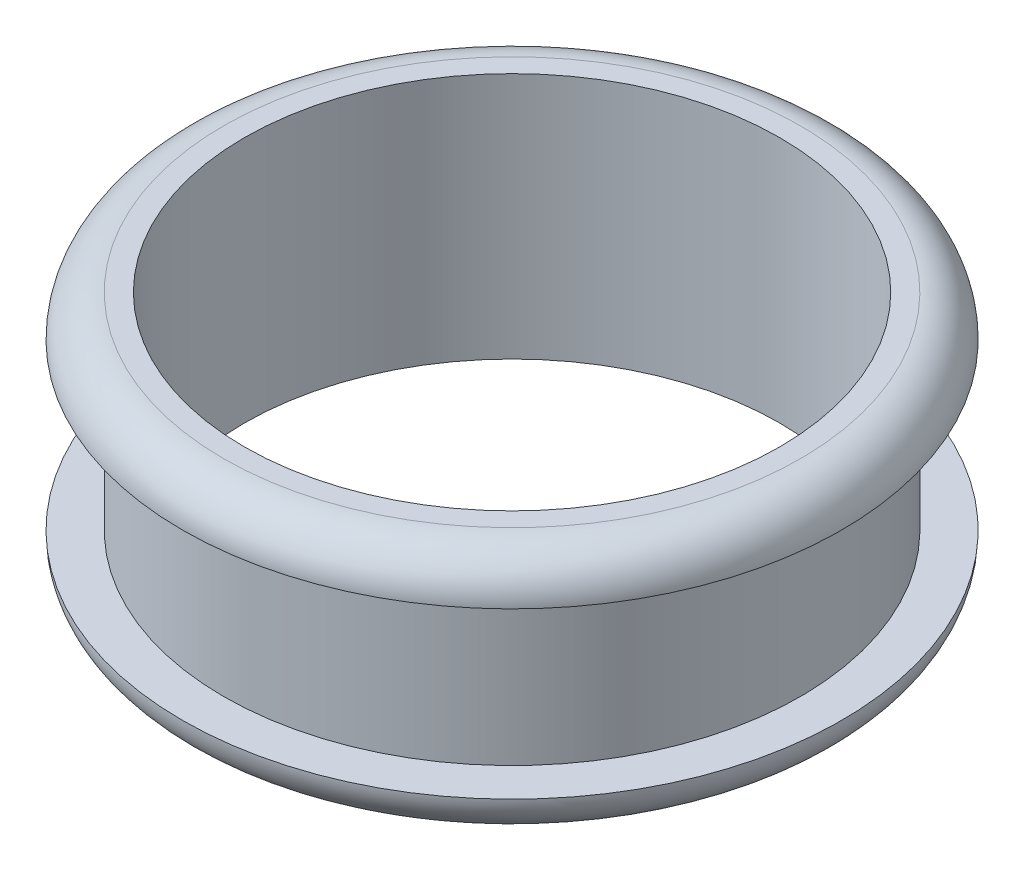
from build123d import *

# Parameters (mm, degrees)
SKETCH1_R               = 4
BOSS_EXTRUDE1_DEPTH     = 1.5
CUT_EXTRUDE1_DEPTH      = 6.852349955
CUT_EXTRUDE1_DEPTH_BACK = 6.852349955
SKETCH2_R               = 3.25
SKETCH4_W               = 0.5
SKETCH4_H               = 2
FILLET1_R               = 0.5


with BuildPart() as part:
    # Sketch1 → Boss-Extrude1 (new, symmetric)
    with BuildSketch(Plane(origin=(0, 0, 0), x_dir=(1, 0, 0), z_dir=(0, 1, 0))):
        with Locations(Location((0, 0, 0), (0, 0, 270))):
            Circle(SKETCH1_R)
    extrude(amount=BOSS_EXTRUDE1_DEPTH, both=True)

    # Sketch2 → Cut-Extrude1 (cut, two sides: drawn at the far end of the back side and taken through both)
    with BuildSketch(Plane(origin=(0, 0, 0), x_dir=(1, 0, 0), z_dir=(0, 1, 0)).offset(-CUT_EXTRUDE1_DEPTH_BACK)):
        with Locations(Location((0, 0, 0), (0, 0, 270))):
            Circle(SKETCH2_R)
    extrude(amount=CUT_EXTRUDE1_DEPTH + CUT_EXTRUDE1_DEPTH_BACK, mode=Mode.SUBTRACT)

    # Sketch4 → Cut-Revolve1 (revolve, cut)
    with BuildSketch(Plane(origin=(0, 0, 0), x_dir=(0, 0, -1), z_dir=(1, 0, 0))):
        with Locations((-3.75, 0)):
            Rectangle(SKETCH4_W, SKETCH4_H)
    revolve(axis=Axis((0, 1.1156594, 0), (0, -1, 0)), mode=Mode.SUBTRACT)

    # Fillet1
    fillet1_edges = [part.edges().sort_by_distance(p)[0] for p in [
        (0, -1.5, -4),
        (0, 1.5, -4),
    ]]
    fillet(fillet1_edges, radius=FILLET1_R - 0.0001)  # a hair under: the kernel refuses the full size


solid = part.part
